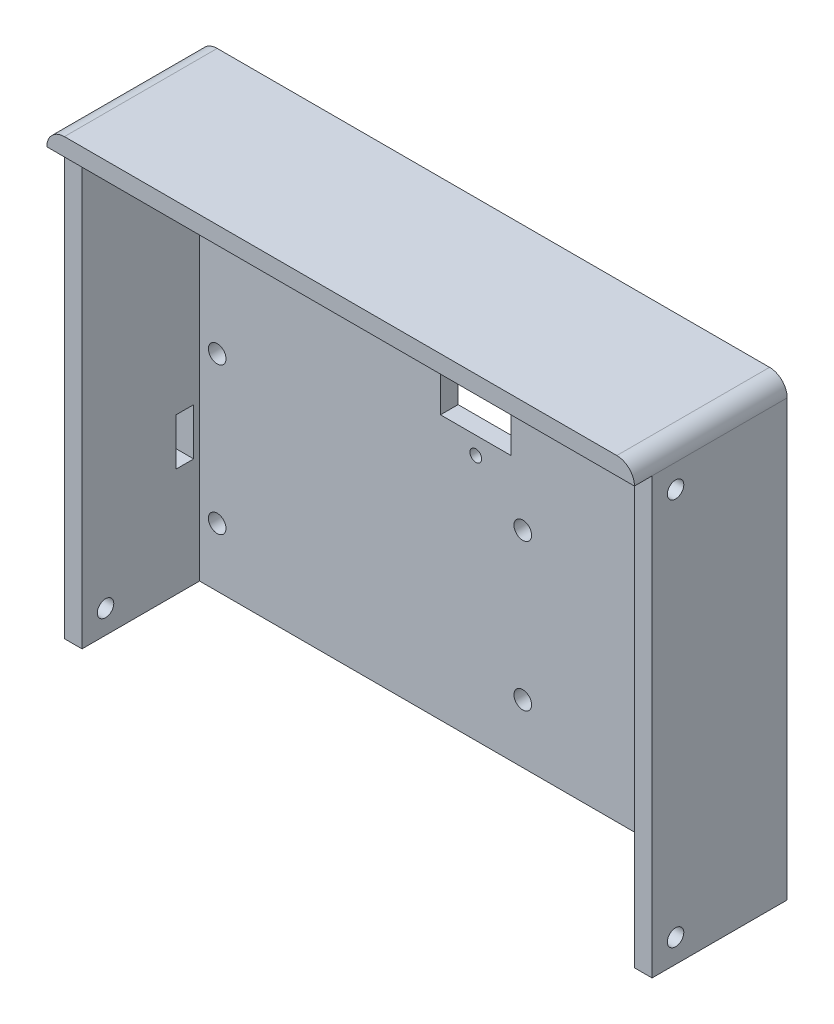
from build123d import *

# Parameters (mm, degrees)
SKETCH1_W            = 100
SKETCH1_H            = 77
BOSS_EXTRUDE1_DEPTH  = 3
BOSS_EXTRUDE2_DEPTH  = 20
SKETCH3_W            = 100
SKETCH3_H            = 3
BOSS_EXTRUDE3_DEPTH  = 3
SKETCH4_W            = 12
SKETCH4_H            = 23
CUT_EXTRUDE1_DEPTH   = 3
SKETCH5_R            = 1.5
CUT_EXTRUDE2_DEPTH   = 129.860389569
LPATTERN1_COUNT      = 2
LPATTERN1_PITCH      = 25
LPATTERN1_COUNT_DIR2 = 2
LPATTERN1_PITCH_DIR2 = 52
SKETCH6_R            = 1.4
CUT_EXTRUDE3_DEPTH   = 129.860389569
CUT_EXTRUDE4_REACH   = 130.86
SKETCH7_W            = 3
SKETCH7_H            = 8
CUT_EXTRUDE5_REACH   = 130.86
SKETCH9_R            = 1
FILLET1_R            = 3


with BuildPart() as part:
    # Sketch1 → Boss-Extrude1 (new body)
    with BuildSketch(Plane.XY):
        with Locations((-50, 38.5)):
            Rectangle(SKETCH1_W, SKETCH1_H)
    extrude(amount=BOSS_EXTRUDE1_DEPTH)

    # Sketch2 → Boss-Extrude2 (add)
    with BuildSketch(Plane.XY.offset(3)):
        Polygon((-100, 77), (-97, 77), (-3, 77), (0, 77), (0, 0), (-3, 0), (-3, 74), (-97, 74), (-97, 0), (-100, 0), align=None)
    extrude(amount=BOSS_EXTRUDE2_DEPTH)

    # Sketch3 → Boss-Extrude3 (add)
    with BuildSketch(Plane.XY.offset(23)):
        with Locations((-50, 75.5)):
            Rectangle(SKETCH3_W, SKETCH3_H)
    extrude(amount=BOSS_EXTRUDE3_DEPTH)

    # Sketch4 → Cut-Extrude1 (cut)
    with BuildSketch(Plane(origin=(0, 0, 0), x_dir=(-1, 0, 0), z_dir=(0, 0, -1))):
        with Locations((50, 56.5)):
            Rectangle(SKETCH4_W, SKETCH4_H)
    extrude(amount=-CUT_EXTRUDE1_DEPTH, mode=Mode.SUBTRACT)

    # Sketch5 → Cut-Extrude2 (cut, through all)
    with BuildSketch(Plane(origin=(0, 0, 0), x_dir=(-1, 0, 0), z_dir=(0, 0, -1))):
        with Locations((94, 10)):
            Circle(SKETCH5_R)
    cut_extrude2 = extrude(amount=-CUT_EXTRUDE2_DEPTH, mode=Mode.SUBTRACT)

    # LPattern1: Cut-Extrude2 2 × 2
    with Locations(*[(j * LPATTERN1_PITCH_DIR2, i * LPATTERN1_PITCH, 0) for i in range(LPATTERN1_COUNT) for j in range(LPATTERN1_COUNT_DIR2) if (i, j) != (0, 0)]):
        add(cut_extrude2, mode=Mode.SUBTRACT)

    # Sketch6 → Cut-Extrude3 (cut, through all)
    with BuildSketch(Plane(origin=(0, 0, 0), x_dir=(0, 0, -1), z_dir=(1, 0, 0))):
        with Locations(Location((-19, 4, 0), (0, 0, 90))):
            Circle(SKETCH6_R)
    cut_extrude3 = extrude(amount=-CUT_EXTRUDE3_DEPTH, mode=Mode.SUBTRACT)

    # Sketch7 → Cut-Extrude4 (cut, up to next)
    with BuildSketch(Plane.ZY.offset(100), mode=Mode.PRIVATE) as cut_extrude4_sk1:
        with Locations((5.5, 22.5)):
            Rectangle(SKETCH7_W, SKETCH7_H)
    cut_extrude4_tool1 = extrude(cut_extrude4_sk1.sketch, amount=-CUT_EXTRUDE4_REACH, mode=Mode.PRIVATE) & part.part
    add(cut_extrude4_tool1.solids().sort_by_distance((-100, 22.5, 5.5))[0], mode=Mode.SUBTRACT)

    # Sketch9 → Cut-Extrude5 (cut, up to next)
    with BuildSketch(Plane(origin=(0, 0, 0), x_dir=(-1, 0, 0), z_dir=(0, 0, -1)), mode=Mode.PRIVATE) as cut_extrude5_sk1:
        with Locations((50, 71)):
            Circle(SKETCH9_R)
    cut_extrude5_tool1 = extrude(cut_extrude5_sk1.sketch, amount=-CUT_EXTRUDE5_REACH, mode=Mode.PRIVATE) & part.part
    cut_extrude5 = cut_extrude5_tool1.solids().sort_by_distance((-50, 71, 0))[0]
    add(cut_extrude5, mode=Mode.SUBTRACT)

    # Mirror1: Cut-Extrude5 across plane
    add(cut_extrude5.mirror(Plane(origin=(0, 56.5, 0), x_dir=(0, 0, 1), z_dir=(0, -1, 0))), mode=Mode.SUBTRACT)

    # Mirror2: Cut-Extrude3 across plane
    add(cut_extrude3.mirror(Plane(origin=(0, 37, 0), x_dir=(0, 0, 1), z_dir=(0, -1, 0))), mode=Mode.SUBTRACT)

    # Fillet1
    fillet1_edges = [part.edges().sort_by_distance(p)[0] for p in [
        (0, 77, 13),
        (-100, 77, 13),
    ]]
    fillet(fillet1_edges, radius=FILLET1_R - 0.0001)  # a hair under: the kernel refuses the full size


solid = part.part
